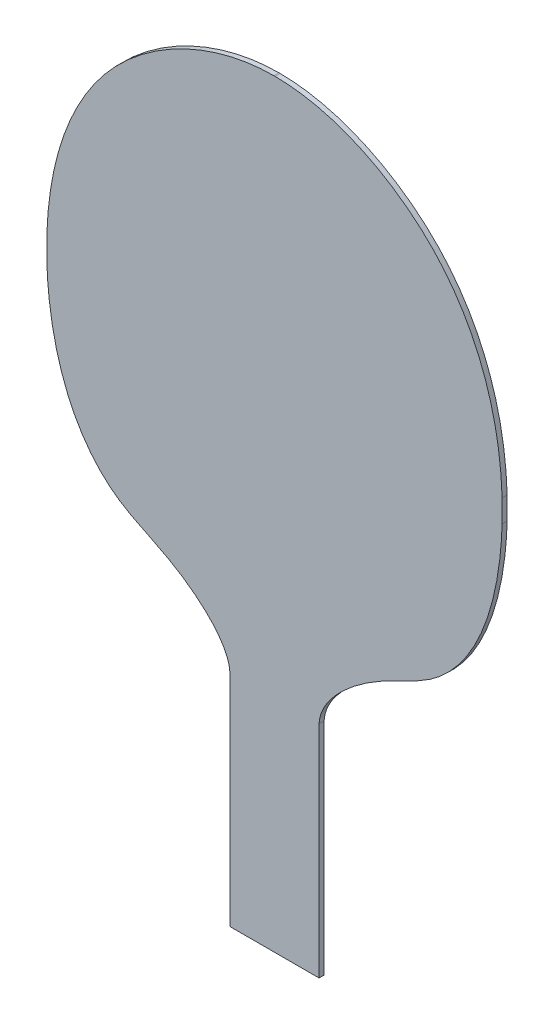
from build123d import *

# Parameters (mm, degrees)
BOSS_EXTRUDE2_DEPTH = 2


with BuildPart() as part:
    # Sketch1 → Boss-Extrude2 (new body)
    with BuildSketch(Plane.XY):
        with BuildLine():
            Line((72.374737303, 86.999859647), (72.374737303, 0))
            Line((72.374737303, 0), (107.625262697, 0))
            Line((107.625262697, 0), (107.625262697, 86.999859647))
            add(Edge.make_bspline(
                [(107.625262697, 86.999859647), (108.054143272, 95.978078118), (127.486643852, 113.866261667), (148.895297768, 121.069134621), (172.848320314, 142.893766889), (179.3317341, 169.378414193), (180, 191.65032035)],
                knots=[0, 0, 0, 0, 0.116860668, 0.211663242, 0.246387134, 0.464099584, 0.464099584, 0.464099584, 0.464099584], degree=3))
            Line((180, 191.65032035), (180, 200.595525294))
            add(Edge.make_bspline(
                [(180, 200.595525294), (179.179346149, 227.438302674), (163.29910964, 275.970123499), (113.184129082, 299.959310061), (90.245728189, 300)],
                knots=[0.493370629, 0.493370629, 0.493370629, 0.493370629, 0.75821873, 0.999139583, 0.999139583, 0.999139583, 0.999139583], degree=3))
            Line((90.245728189, 300), (90, 300))
            Line((90, 300), (89.754271811, 300))
            add(Edge.make_bspline(
                [(0, 200.595525294), (0.820653851, 227.438302674), (16.70089036, 275.970123499), (66.815870918, 299.959310061), (89.754271811, 300)],
                knots=[0.493370629, 0.493370629, 0.493370629, 0.493370629, 0.75821873, 0.999139583, 0.999139583, 0.999139583, 0.999139583], degree=3))
            Line((0, 200.595525294), (0, 191.65032035))
            add(Edge.make_bspline(
                [(72.374737303, 86.999859647), (71.945856728, 95.978078118), (52.513356148, 113.866261667), (31.104702232, 121.069134621), (7.151679686, 142.893766889), (0.6682659, 169.378414193), (0, 191.65032035)],
                knots=[0, 0, 0, 0, 0.116860668, 0.211663242, 0.246387134, 0.464099584, 0.464099584, 0.464099584, 0.464099584], degree=3))
        make_face()
    extrude(amount=BOSS_EXTRUDE2_DEPTH)


solid = part.part
